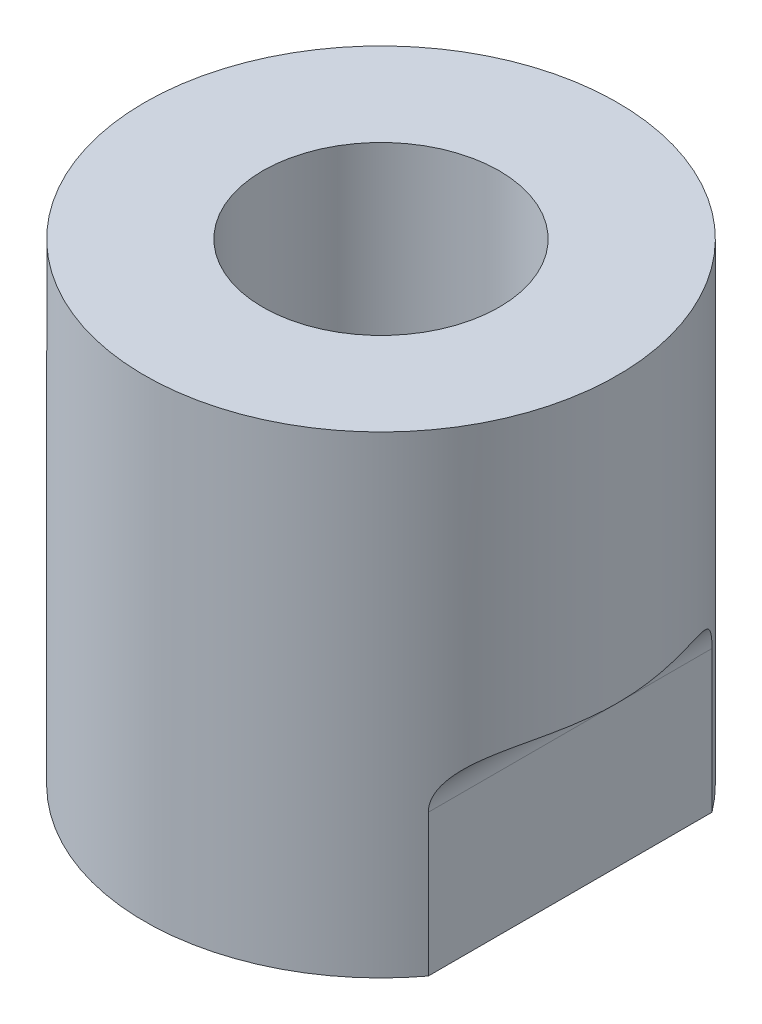
from build123d import *

# Parameters (mm, degrees)
ESBO_O2_R                  = 4.9
CORTE_EXTRUS_O1_DEPTH      = 10
CHANFRO1_SIZE              = 0.5
CORTE_EXTRUS_O2_DEPTH      = 62.23724357
CORTE_EXTRUS_O2_DEPTH_BACK = 62.23724357
ESBO_O3_W                  = 5
ESBO_O3_H                  = 20
FILETE1_R                  = 5


with BuildPart() as part:
    # Esboço1 → Revolução1 (revolve)
    with BuildSketch(Plane.XY):
        Polygon((0, 0), (-25, 0), (-25, 50), (-12.5, 50), (-12.5, 10), (0, 10), align=None)
    revolve(axis=Axis((0, 10, 0), (0, -1, 0)))

    # Esboço2 → Corte-extrusão1 (cut)
    with BuildSketch(Plane(origin=(0, 10, 0), x_dir=(1, 0, 0), z_dir=(0, 1, 0))):
        with Locations(Location((0, 7, 0), (0, 0, 180))):
            Circle(ESBO_O2_R)
        with Locations(Location((0, -7, 0), (0, 0, 180))):
            Circle(ESBO_O2_R)
    extrude(amount=-CORTE_EXTRUS_O1_DEPTH, mode=Mode.SUBTRACT)

    # Chanfro1
    chanfro1_edges = [part.edges().sort_by_distance(p)[0] for p in [
        (4.9, 0, -7),
        (4.9, 0, 7),
    ]]
    chamfer(chanfro1_edges, length=CHANFRO1_SIZE)

    # Esboço3 → Corte-extrusão2 (cut, two sides: drawn at the far end of the back side and taken through both)
    with BuildSketch(Plane.XY.offset(-CORTE_EXTRUS_O2_DEPTH_BACK)):
        with Locations((-22.5, 10)):
            Rectangle(ESBO_O3_W, ESBO_O3_H)
        with Locations((22.5, 10)):
            Rectangle(ESBO_O3_W, ESBO_O3_H)
    extrude(amount=CORTE_EXTRUS_O2_DEPTH + CORTE_EXTRUS_O2_DEPTH_BACK, mode=Mode.SUBTRACT)

    # Filete1
    filete1_edges = [part.edges().sort_by_distance(p)[0] for p in [
        (20, 20, 0),
        (-20, 20, 0),
    ]]
    fillet(filete1_edges, radius=FILETE1_R - 0.0001)  # a hair under: the kernel refuses the full size


solid = part.part
